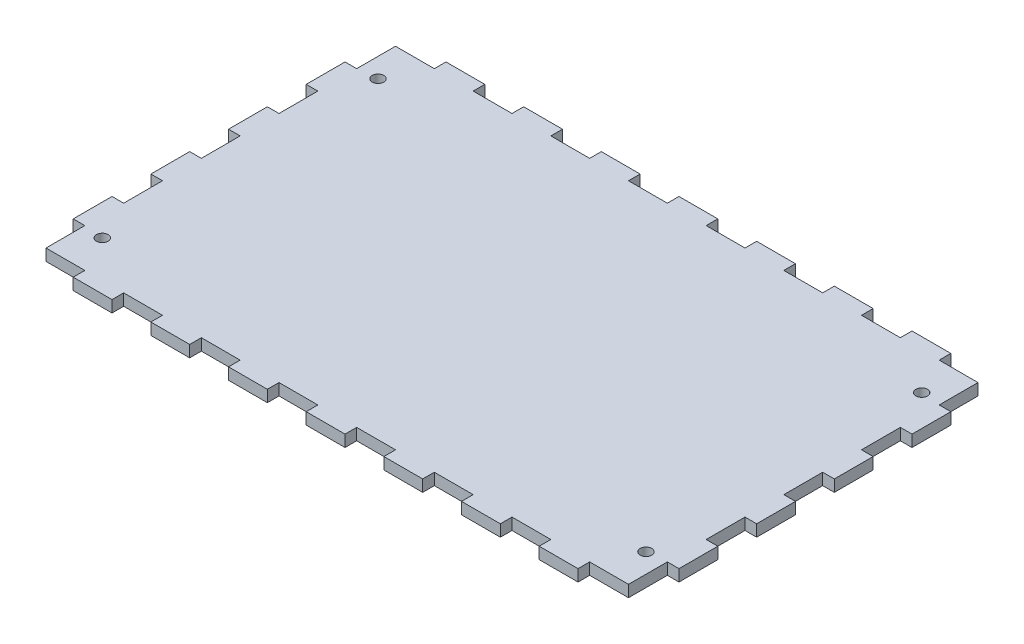
from build123d import *

# Parameters (mm, degrees)
BOSS_EXTRUDE1_DEPTH = 3
SKETCH2_R           = 1.5
CUT_EXTRUDE1_DEPTH  = 3


with BuildPart() as part:
    # Sketch1 → Boss-Extrude1 (new body)
    with BuildSketch(Plane(origin=(0, 0, 0), x_dir=(1, 0, 0), z_dir=(0, 1, 0))):
        Polygon((-5, 48), (5, 48), (5, 45), (15, 45), (15, 48), (25, 48), (25, 45), (35, 45), (35, 48), (45, 48), (45, 45), (55, 45), (55, 48), (65, 48), (65, 45), (75, 45), (75, 35), (78, 35), (78, 25), (75, 25), (75, 15), (78, 15), (78, 5), (75, 5), (75, -5), (78, -5), (78, -15), (75, -15), (75, -25), (78, -25), (78, -35), (75, -35), (75, -45), (65, -45), (65, -48), (55, -48), (55, -45), (45, -45), (45, -48), (35, -48), (35, -45), (25, -45), (25, -48), (15, -48), (15, -45), (5, -45), (5, -48), (-5, -48), (-5, -45), (-15, -45), (-15, -48), (-25, -48), (-25, -45), (-35, -45), (-35, -48), (-45, -48), (-45, -45), (-55, -45), (-55, -48), (-65, -48), (-65, -45), (-75, -45), (-75, -35), (-78, -35), (-78, -25), (-75, -25), (-75, -15), (-78, -15), (-78, -5), (-75, -5), (-75, 5), (-78, 5), (-78, 15), (-75, 15), (-75, 25), (-78, 25), (-78, 35), (-75, 35), (-75, 45), (-65, 45), (-65, 48), (-55, 48), (-55, 45), (-45, 45), (-45, 48), (-35, 48), (-35, 45), (-25, 45), (-25, 48), (-15, 48), (-15, 45), (-5, 45), align=None)
    extrude(amount=BOSS_EXTRUDE1_DEPTH)

    # Sketch2 → Cut-Extrude1 (cut)
    with BuildSketch(Plane(origin=(0, 3, 0), x_dir=(1, 0, 0), z_dir=(0, 1, 0))):
        with Locations((70, 35.5)):
            Circle(SKETCH2_R)
        with Locations((-70, 35.5)):
            Circle(SKETCH2_R)
        with Locations((70, -35.5)):
            Circle(SKETCH2_R)
        with Locations((-70, -35.5)):
            Circle(SKETCH2_R)
    extrude(amount=-CUT_EXTRUDE1_DEPTH, mode=Mode.SUBTRACT)


solid = part.part
